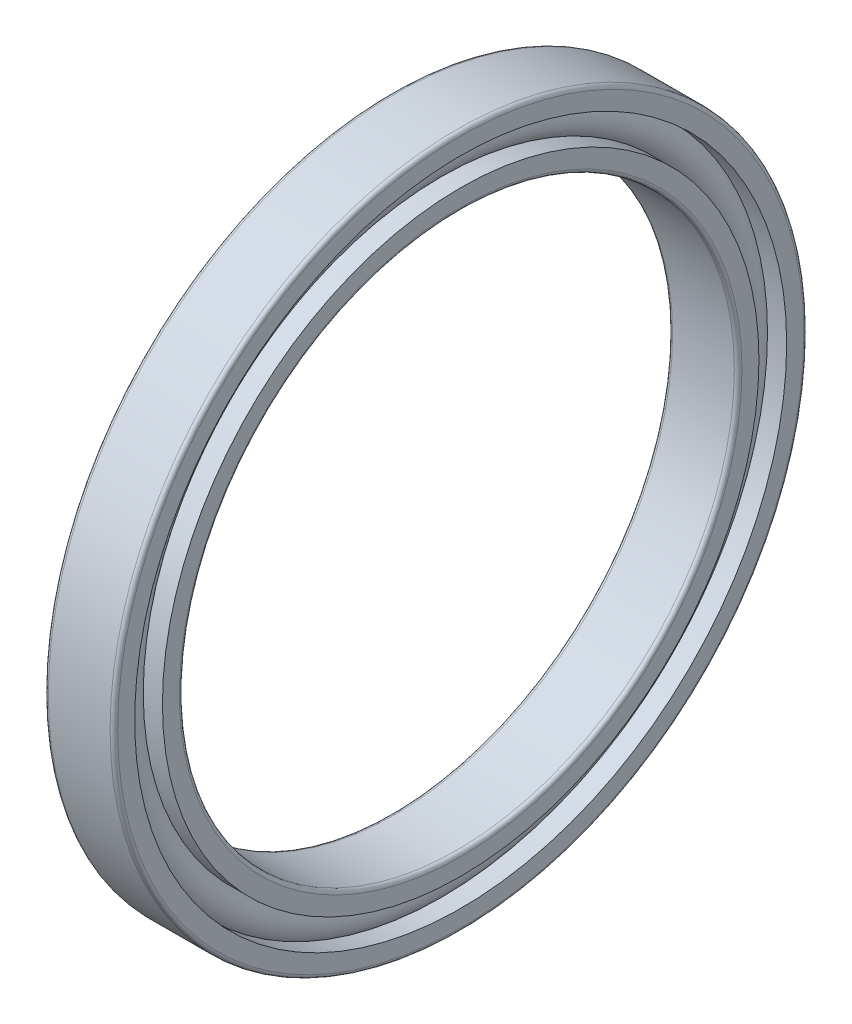
from build123d import *

# Parameters (mm, degrees)
CAGSPISKE_W     = 1.2
CAGSPISKE_H     = 2
CAGESPINE_ANGLE = 0.001
BALSIMSKE_R     = 6


with BuildPart() as part:
    # CagSpiSke → CageSpine (revolve)
    with BuildSketch(Plane.XY):
        with Locations((0, 90)):
            Rectangle(CAGSPISKE_W, CAGSPISKE_H)
    revolve(axis=Axis((-20.6375, 0, 0), (-1, 0, 0)), revolution_arc=CAGESPINE_ANGLE)

    # BalSimSke → BallsSimplified (revolve)
    with BuildSketch(Plane.XY):
        with Locations((0, 90)):
            Circle(BALSIMSKE_R)
    revolve(axis=Axis((-10, 0, 0), (1, 0, 0)))

    # InnRacSke → InnerRace (revolve)
    with BuildSketch(Plane.XY):
        with BuildLine():
            Line((-4.438538611, 86), (-10, 86))
            Line((-10, 86), (-10, 81.1))
            ThreePointArc((-10, 81.1), (-9.677817459, 80.322182541), (-8.9, 80))
            Line((-8.9, 80), (8.9, 80))
            ThreePointArc((8.9, 80), (9.677817459, 80.322182541), (10, 81.1))
            Line((10, 81.1), (10, 86))
            Line((10, 86), (4.438538611, 86))
            ThreePointArc((4.438538611, 86), (0, 84.025), (-4.438538611, 86))
        make_face()
    revolve(axis=Axis((-20.6375, 0, 0), (1, 0, 0)))

    # OutRacSke → OuterRace (revolve)
    with BuildSketch(Plane.XY):
        with BuildLine():
            Line((-4.438538611, 94), (-10, 94))
            Line((-10, 94), (-10, 98.9))
            ThreePointArc((-10, 98.9), (-9.677817459, 99.677817459), (-8.9, 100))
            Line((-8.9, 100), (8.9, 100))
            ThreePointArc((8.9, 100), (9.677817459, 99.677817459), (10, 98.9))
            Line((10, 98.9), (10, 94))
            Line((10, 94), (4.438538611, 94))
            ThreePointArc((4.438538611, 94), (0, 95.975), (-4.438538611, 94))
        make_face()
    revolve(axis=Axis((-20.6375, 0, 0), (1, 0, 0)))


solid = part.part
